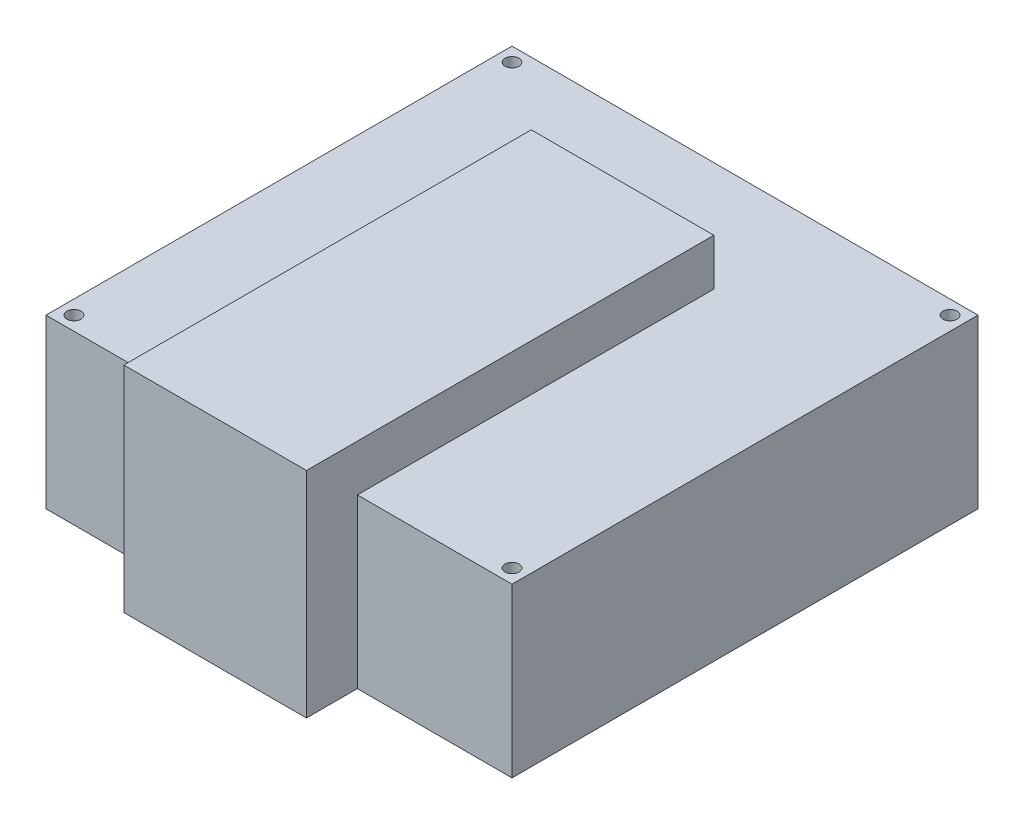
from build123d import *

# Parameters (mm, degrees)
SKETCH1_W           = 100
SKETCH1_H           = 100
BOSS_EXTRUDE1_DEPTH = 46
CUT_EXTRUDE1_DEPTH  = 10
SKETCH3_R           = 1.5
CUT_EXTRUDE2_DEPTH  = 149.71449156
SKETCH4_W           = 39.192258769
SKETCH4_H           = 46
BOSS_EXTRUDE2_DEPTH = 10.922


with BuildPart() as part:
    # Sketch1 → Boss-Extrude1 (new body)
    with BuildSketch(Plane(origin=(0, 0, 0), x_dir=(1, 0, 0), z_dir=(0, 1, 0))):
        with Locations((50, 50)):
            Rectangle(SKETCH1_W, SKETCH1_H)
    extrude(amount=BOSS_EXTRUDE1_DEPTH)

    # Sketch2 → Cut-Extrude1 (cut)
    with BuildSketch(Plane(origin=(0, 46, 0), x_dir=(1, 0, 0), z_dir=(0, 1, 0))):
        Polygon((66.818964176, 76.503466617), (66.818964176, 0), (100, 0), (100, 100), (0, 100), (0, 0), (27.626705407, 0), (27.626705407, 76.503466617), align=None)
    extrude(amount=-CUT_EXTRUDE1_DEPTH, mode=Mode.SUBTRACT)

    # Sketch3 → Cut-Extrude2 (cut, through all)
    with BuildSketch(Plane.XZ):
        with Locations((97, -97)):
            Circle(SKETCH3_R)
        with Locations((3, -97)):
            Circle(SKETCH3_R)
        with Locations((3, -3)):
            Circle(SKETCH3_R)
        with Locations((97, -3)):
            Circle(SKETCH3_R)
    extrude(amount=-CUT_EXTRUDE2_DEPTH, mode=Mode.SUBTRACT)

    # Sketch4 → Boss-Extrude2 (add)
    with BuildSketch(Plane.XY):
        with Locations((47.222834792, 23)):
            Rectangle(SKETCH4_W, SKETCH4_H)
    extrude(amount=BOSS_EXTRUDE2_DEPTH)


solid = part.part
